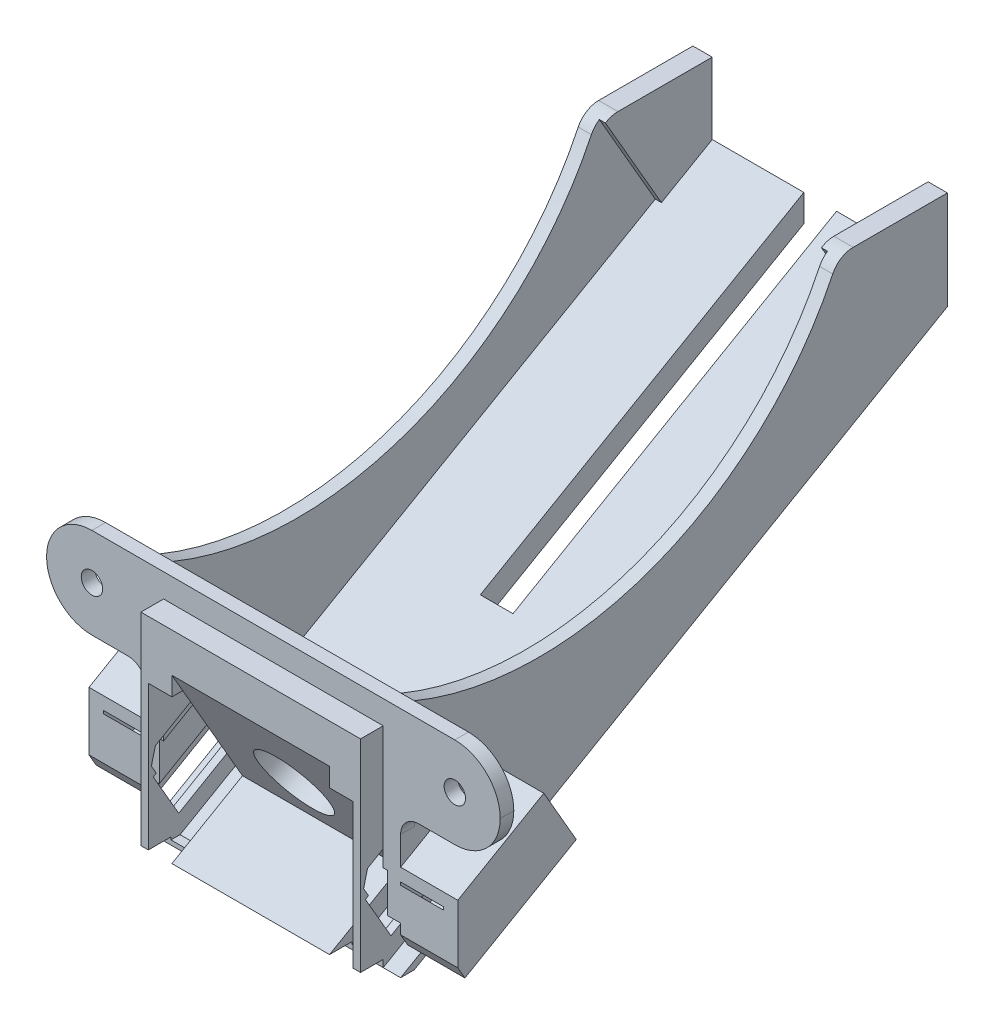
from build123d import *
from OCP.BRepAlgoAPI import BRepAlgoAPI_Cut
from OCP.TopTools import TopTools_ListOfShape

# Parameters (mm, degrees)
SKETCH2_R                       = 1.5
FRONT_PLATE_EXTRUDE_DEPTH       = 1.905
INSET_START                     = 1.905
SKETCH2_3_W                     = 30.746
SKETCH2_3_H                     = 28.321
SKETCH2_3_W_2                   = 28.746
SKETCH2_3_H_2                   = 26.321
INSET_EXTRUDE_DEPTH             = 3.175
BOTTLE_HOLDER_EXTRUDE_DEPTH     = 17.8125
BOTTLE_HOLDER_CUTOUT_DEPTH      = 15.113
SKETCH3_4_R                     = 45.655613694
ACCESS_HOLE_CUT1_DEPTH          = 11.03248959
SIPPER_HOLE_CUT_REACH           = 93.898
SKETCH6_R                       = 5.08
IR_LENS_1_DEPTH                 = 3.302
IR_START                        = 22.064979
IR_LENS_2_DEPTH                 = 3.302
IR_SLOT_CUT_OUTLINE_W           = 1.03851041
IR_SLOT_CUT_OUTLINE_H           = 10.146865
IR_SLOT_CUT_DEPTH               = 78.926684549
IR_MATRL_FILL_1_DEPTH           = 1.03851041
IR_START_2                      = -29.70749
IR_MATRL_FILL_2_DEPTH           = 1.03851041
CUT_EXTRUDE3_DEPTH              = 19.05
CUT_EXTRUDE3_DEPTH_BACK         = 7.62
SKETCH8_5_W                     = 2.439500062
SKETCH8_5_H                     = 5.73181937
CUT_EXTRUDE10_REACH             = 93.898
SKETCH32_W                      = 0.5999988
SKETCH32_H                      = 8.146865
CUT_EXTRUDE10_DIRECTION_2_REACH = 93.898
BOSS_EXTRUDE4_DEPTH             = 1.5
BOSS_EXTRUDE5_START             = -28.668979
BOSS_EXTRUDE5_DEPTH             = 1.5
FILLET4_R                       = 6.35
FILLET6_R                       = 3.175
WIRE_START                      = -3.28745457
WIRE_SLOT_CUT_OUTLINE_W         = 4.572
WIRE_SLOT_CUT_OUTLINE_H         = 52.293761458
WIRE_SLOT_CUT_DEPTH             = 3.28745457
FILLET9_R                       = 2.54
CUT_EXTRUDE11_REACH             = 86.319
SKETCH35_W                      = 0.8599988
SKETCH35_H                      = 17.011686888
FILLET10_START                  = -12.206513125
FILLET10_DEPTH                  = 1.838259089
FILLET10_START_2                = -10.368254036
FILLET10_2_DEPTH                = 1.274362516
FILLET10_START_3                = -9.318765864
FILLET10_3_DEPTH                = 1.318765864
BOSS_EXTRUDE6_DEPTH             = 8
SKETCH39_W                      = 6
SKETCH39_H                      = 6
CUT_EXTRUDE13_DEPTH             = 15
CUT_EXTRUDE14_DEPTH             = 8


with BuildPart() as part:
    # Sketch2 → Front Plate Extrude (new body)
    with BuildSketch(Plane.XY):
        Polygon((-31.75, 6.35), (31.75, 6.35), (31.75, -6.35), (17.8125, -6.35), (17.8125, -26.273), (-17.8125, -26.273), (-17.8125, -6.35), (-31.75, -6.35), align=None)
        with Locations(Location((-25.4, 0, 0), (0, 0, 180))):
            Circle(SKETCH2_R, mode=Mode.SUBTRACT)
        with Locations(Location((25.4, 0, 0), (0, 0, 180))):
            Circle(SKETCH2_R, mode=Mode.SUBTRACT)
    extrude(amount=FRONT_PLATE_EXTRUDE_DEPTH)

    # Sketch2<3> → Inset Extrude (add)
    # profile 1 of 2: a face of its own
    with BuildSketch(Plane.XY.offset(INSET_START)):
        with Locations((0, -11.1125)):
            Rectangle(SKETCH2_3_W, SKETCH2_3_H)
        with Locations((0, -11.1125)):
            Rectangle(SKETCH2_3_W_2, SKETCH2_3_H_2, mode=Mode.SUBTRACT)
    # profile 2 of 2: a face of its own
    with BuildSketch(Plane.XY.offset(INSET_START)):
        with Locations((0, -11.1125)):
            Rectangle(SKETCH2_3_W_2, SKETCH2_3_H_2)
    extrude(amount=INSET_EXTRUDE_DEPTH)

    # Sketch3 → Bottle Holder Extrude (add, symmetric)
    with BuildSketch(Plane(origin=(0, 0, 0), x_dir=(0, 0, -1), z_dir=(1, 0, 0))):
        with BuildLine():
            Line((0, 6.35), (0, -26.273))
            Line((0, -26.273), (74.637698823, 16.819095507))
            Line((74.637698823, 16.819095507), (74.637698823, 30.598392845))
            Line((74.637698823, 30.598392845), (59.397698823, 30.598392845))
            ThreePointArc((59.397698823, 30.598392845), (34.675938772, 6.282557302), (0, 6.35))
        make_face()
    extrude(amount=BOTTLE_HOLDER_EXTRUDE_DEPTH, both=True)

    # Sketch3<7> → Bottle Holder Cutout (cut, symmetric)
    with BuildSketch(Plane(origin=(0, 0, 0), x_dir=(0, 0, -1), z_dir=(1, 0, 0))):
        with BuildLine():
            ThreePointArc((59.397698823, 30.598392845), (34.675938772, 6.282557302), (0, 6.35))
            Line((0, 6.35), (8.989714143, -14.111334078))
            Line((8.989714143, -14.111334078), (41.609102242, 4.721478422))
            Line((41.609102242, 4.721478422), (42.984102242, 2.339908562))
            Line((42.984102242, 2.339908562), (74.637698823, 20.615121069))
            Line((74.637698823, 20.615121069), (74.637698823, 30.598392845))
            Line((74.637698823, 30.598392845), (59.397698823, 30.598392845))
        make_face()
        Polygon((10.102558342, -16.64425966), (8.989714143, -14.111334078), (41.609102242, 4.721478422), (42.984102242, 2.339908562), align=None)
    extrude(amount=BOTTLE_HOLDER_CUTOUT_DEPTH, both=True, mode=Mode.SUBTRACT)

    # Sketch3<4> → Access Hole Cut1 (cut, symmetric)
    with BuildSketch(Plane(origin=(0, 0, 0), x_dir=(0, 0, -1), z_dir=(1, 0, 0))):
        with Locations((17.420114638, 48.55159556)):
            Circle(SKETCH3_4_R)
        Polygon((-5.08, -2.441874335), (4.806167412, -19.565218584), (-5.08, -25.273), align=None)
        Polygon((8.989714143, -14.111334078), (41.609102242, 4.721478422), (42.984102242, 2.339908562), (10.102558342, -16.64425966), align=None)
    extrude(amount=ACCESS_HOLE_CUT1_DEPTH, both=True, mode=Mode.SUBTRACT)

    # Sipper Hole Cut: up to this plane
    sipper_hole_cut_end = Plane(origin=(-15.113, 1.027416141, -2.338484246), z_dir=(0, 0.40224099428432425, -0.9155338237974381))
    # Sketch6 → Sipper Hole Cut (cut, up to the surface)
    with BuildSketch(Plane(origin=(0, -2.810173109, 4.867362603), x_dir=(1, 0, 0), z_dir=(0, -0.5000000000000001, 0.8660254037844386)), mode=Mode.PRIVATE) as sipper_hole_cut_sk1:
        with Locations(Location((0, -11.72706003, 0), (0, 0, 270))):
            Circle(SKETCH6_R)
    sipper_hole_cut_tool1 = split(extrude(sipper_hole_cut_sk1.sketch, amount=-SIPPER_HOLE_CUT_REACH, mode=Mode.PRIVATE), bisect_by=sipper_hole_cut_end, keep=Keep.BOTH, mode=Mode.PRIVATE)
    add(sipper_hole_cut_tool1.solids().sort_by_distance((0, -12.966105, -0.996167))[0], mode=Mode.SUBTRACT)

    # Sketch9 → IR Lens 1 (cut)
    with BuildSketch(Plane.ZY.offset(-11.03248959)):
        Polygon((-8.275871937, -20.494923109), (0.635, -25.639617421), (5.08, -25.639617421), (5.08, -5.060840174), (0.635, -5.060840174), align=None)
    extrude(amount=-IR_LENS_1_DEPTH, mode=Mode.SUBTRACT)

    # Sketch9<2> → IR Lens 2 (cut)
    with BuildSketch(Plane.ZY.offset(-11.03248959).offset(IR_START)):
        Polygon((-8.275871937, -20.494923109), (0.635, -25.639617421), (5.08, -25.639617421), (5.08, -5.060840174), (0.635, -5.060840174), align=None)
    extrude(amount=IR_LENS_2_DEPTH, mode=Mode.SUBTRACT)

    # IR Slot Cut: read off the stored shape, not the designer's step
    # IR Slot Cut outline → IR Slot Cut (cut)
    with BuildSketch(Plane(origin=(0, -42.178380842, -10.278703561), x_dir=(1, 0, 0), z_dir=(0, 0.5000000000000007, -0.8660254037844383))):
        with Locations((-14.853744795, -27.274702716)):
            Rectangle(IR_SLOT_CUT_OUTLINE_W, IR_SLOT_CUT_OUTLINE_H)
        with Locations((14.853744795, -27.274702716)):
            Rectangle(IR_SLOT_CUT_OUTLINE_W, IR_SLOT_CUT_OUTLINE_H)
    extrude(amount=IR_SLOT_CUT_DEPTH, mode=Mode.SUBTRACT)

    # Sketch31 → IR Matrl Fill 1 (add)
    with BuildSketch(Plane(origin=(15.373, 0, 0), x_dir=(0, 0, -1), z_dir=(1, 0, 0))):
        Polygon((-4.090132963, -13.121823327), (-5.08, -13.693323327), (-5.08, -15.576325935), (-4.395369047, -16.76214153), (-3.962357211, -16.51214203), (-4.64949122, -15.321991015), align=None)
    extrude(amount=-IR_MATRL_FILL_1_DEPTH)

    # Sketch31<2> → IR Matrl Fill 2 (add)
    with BuildSketch(Plane(origin=(15.373, 0, 0), x_dir=(0, 0, -1), z_dir=(1, 0, 0)).offset(IR_START_2)):
        Polygon((-4.090132963, -13.121823327), (-5.08, -13.693323327), (-5.08, -15.576325935), (-4.395369047, -16.76214153), (-3.962357211, -16.51214203), (-4.64949122, -15.321991015), align=None)
    extrude(amount=-IR_MATRL_FILL_2_DEPTH)

    # Sketch8<5> → Cut-Extrude3 (cut, two sides: drawn at the far end of the back side and taken through both)
    with BuildSketch(Plane(origin=(0, -42.178380842, -10.278703561), x_dir=(1, 0, 0), z_dir=(0, 0.5000000000000007, -0.8660254037844383)).offset(-CUT_EXTRUDE3_DEPTH_BACK)):
        with Locations((16.592750031, -22.732225331)):
            Rectangle(SKETCH8_5_W, SKETCH8_5_H)
        with Locations((-16.592750031, -22.732225331)):
            Rectangle(SKETCH8_5_W, SKETCH8_5_H)
    extrude(amount=CUT_EXTRUDE3_DEPTH + CUT_EXTRUDE3_DEPTH_BACK, mode=Mode.SUBTRACT)

    # Cut-Extrude10: up to this face of the body (flat: up to its plane)
    cut_extrude10_end = Plane(part.part.faces().sort_by_distance((15.243, 20.905546866, -64.993866059))[0])
    # Sketch32 → Cut-Extrude10 (cut, up to the picked face)
    with BuildSketch(Plane(origin=(0, -2.810173109, 4.867362603), x_dir=(1, 0, 0), z_dir=(0, -0.5000000000000006, 0.8660254037844383)), mode=Mode.PRIVATE) as cut_extrude10_sk1:
        with Locations((15.6729994, -15.392198364)):
            Rectangle(SKETCH32_W, SKETCH32_H)
    cut_extrude10_tool1 = split(extrude(cut_extrude10_sk1.sketch, amount=-CUT_EXTRUDE10_REACH, mode=Mode.PRIVATE), bisect_by=cut_extrude10_end, keep=Keep.BOTH, mode=Mode.PRIVATE)
    # Sketch32 → Cut-Extrude10 (cut, up to the picked face)
    with BuildSketch(Plane(origin=(0, -2.810173109, 4.867362603), x_dir=(1, 0, 0), z_dir=(0, -0.5000000000000006, 0.8660254037844383)), mode=Mode.PRIVATE) as cut_extrude10_sk2:
        with Locations((-15.6729994, -15.392198364)):
            Rectangle(SKETCH32_W, SKETCH32_H)
    cut_extrude10_tool2 = split(extrude(cut_extrude10_sk2.sketch, amount=-CUT_EXTRUDE10_REACH, mode=Mode.PRIVATE), bisect_by=cut_extrude10_end, keep=Keep.BOTH, mode=Mode.PRIVATE)
    add(cut_extrude10_tool1.solids().sort_by(Axis((15.672999, -16.140208, -2.828737), (0, 0.5000000000000006, -0.8660254037844383)))[0], mode=Mode.SUBTRACT)
    add(cut_extrude10_tool2.solids().sort_by(Axis((-15.672999, -16.140208, -2.828737), (0, 0.5000000000000006, -0.8660254037844383)))[0], mode=Mode.SUBTRACT)

    # Cut-Extrude10 direction 2: up to this face of the body (flat: up to its plane)
    cut_extrude10_direction_2_end = Plane(part.part.faces().sort_by_distance((14.853744795, -19.856829184, 2.608650297))[0])
    # Sketch32 → Cut-Extrude10 direction 2 (cut, up to the picked face)
    with BuildSketch(Plane(origin=(0, -2.810173109, 4.867362603), x_dir=(1, 0, 0), z_dir=(0, -0.5000000000000006, 0.8660254037844383)), mode=Mode.PRIVATE) as cut_extrude10_direction_2_sk1:
        with Locations((15.6729994, -15.392198364)):
            Rectangle(SKETCH32_W, SKETCH32_H)
    cut_extrude10_direction_2_tool1 = split(extrude(cut_extrude10_direction_2_sk1.sketch, amount=CUT_EXTRUDE10_DIRECTION_2_REACH, mode=Mode.PRIVATE), bisect_by=cut_extrude10_direction_2_end, keep=Keep.BOTH, mode=Mode.PRIVATE)
    # Sketch32 → Cut-Extrude10 direction 2 (cut, up to the picked face)
    with BuildSketch(Plane(origin=(0, -2.810173109, 4.867362603), x_dir=(1, 0, 0), z_dir=(0, -0.5000000000000006, 0.8660254037844383)), mode=Mode.PRIVATE) as cut_extrude10_direction_2_sk2:
        with Locations((-15.6729994, -15.392198364)):
            Rectangle(SKETCH32_W, SKETCH32_H)
    cut_extrude10_direction_2_tool2 = split(extrude(cut_extrude10_direction_2_sk2.sketch, amount=CUT_EXTRUDE10_DIRECTION_2_REACH, mode=Mode.PRIVATE), bisect_by=cut_extrude10_direction_2_end, keep=Keep.BOTH, mode=Mode.PRIVATE)
    add(cut_extrude10_direction_2_tool1.solids().sort_by(Axis((15.672999, -16.140208, -2.828737), (0, -0.5000000000000006, 0.8660254037844383)))[0], mode=Mode.SUBTRACT)
    add(cut_extrude10_direction_2_tool2.solids().sort_by(Axis((-15.672999, -16.140208, -2.828737), (0, -0.5000000000000006, 0.8660254037844383)))[0], mode=Mode.SUBTRACT)

    # Sketch34 → Boss-Extrude4 (add)
    with BuildSketch(Plane(origin=(14.33448959, 0, 0), x_dir=(0, 0, -1), z_dir=(1, 0, 0))):
        Polygon((6.805761449, -9.140476832), (10.102558342, -16.64425966), (14.227004327, -14.26300966), (10.930207434, -6.759226832), align=None)
    extrude(amount=-BOSS_EXTRUDE4_DEPTH)

    # Sketch34<2> → Boss-Extrude5 (add)
    with BuildSketch(Plane(origin=(14.33448959, 0, 0), x_dir=(0, 0, -1), z_dir=(1, 0, 0)).offset(BOSS_EXTRUDE5_START)):
        Polygon((6.805761449, -9.140476832), (10.102558342, -16.64425966), (14.227004327, -14.26300966), (10.930207434, -6.759226832), align=None)
    extrude(amount=BOSS_EXTRUDE5_DEPTH)

    # Fillet4
    fillet4_edges = [part.edges().sort_by_distance(p)[0] for p in [
        (-31.75, -6.35, 0.9525),
        (31.75, -6.35, 0.9525),
        (31.75, 6.35, 0.9525),
        (-31.75, 6.35, 0.9525),
    ]]
    fillet(fillet4_edges, radius=FILLET4_R - 0.0001)  # a hair under: the kernel refuses the full size

    # Fillet6
    fillet6_edges = [part.edges().sort_by_distance(p)[0] for p in [
        (16.46275, 30.598392845, -59.397698823),
        (-16.46275, 30.598392845, -59.397698823),
    ]]
    fillet(fillet6_edges, radius=FILLET6_R)

    # Wire Slot Cut: read off the stored shape, not the designer's step
    # Wire Slot Cut outline → Wire Slot Cut (cut)
    with BuildSketch(Plane(origin=(0, -16.857730829, -9.732815432), x_dir=(1, 0, 0), z_dir=(0, 0.8660254037844386, 0.5000000000000002)).offset(WIRE_START)):
        with Locations((0, 48.798823066)):
            Rectangle(WIRE_SLOT_CUT_OUTLINE_W, WIRE_SLOT_CUT_OUTLINE_H)
    extrude(amount=WIRE_SLOT_CUT_DEPTH, mode=Mode.SUBTRACT)

    # Fillet9
    fillet9_edges = [part.edges().sort_by_distance(p)[0] for p in [
        (17.8125, -6.35, 0.9525),
        (-17.8125, -6.35, 0.9525),
    ]]
    fillet(fillet9_edges, radius=FILLET9_R)

    # Cut-Extrude11: up to this face of the body (flat: up to its plane)
    cut_extrude11_end = Plane(part.part.faces().sort_by_distance((15.522272109, 20.343088544, -65.318601523))[0])
    # Sketch35 → Cut-Extrude11 (cut, up to the picked face)
    with BuildSketch(Plane(origin=(0, 1.027416141, -2.338484246), x_dir=(-1, 0, 0), z_dir=(0, 0.4022409942843238, -0.9155338237974383)), mode=Mode.PRIVATE) as cut_extrude11_sk1:
        with Locations((-15.5429994, -2.692203663)):
            Rectangle(SKETCH35_W, SKETCH35_H)
    cut_extrude11_tool1 = split(extrude(cut_extrude11_sk1.sketch, amount=CUT_EXTRUDE11_REACH, mode=Mode.PRIVATE), bisect_by=cut_extrude11_end, keep=Keep.BOTH, mode=Mode.PRIVATE)
    # Sketch35 → Cut-Extrude11 (cut, up to the picked face)
    with BuildSketch(Plane(origin=(0, 1.027416141, -2.338484246), x_dir=(-1, 0, 0), z_dir=(0, 0.4022409942843238, -0.9155338237974383)), mode=Mode.PRIVATE) as cut_extrude11_sk2:
        with Locations((15.5429994, -2.692203663)):
            Rectangle(SKETCH35_W, SKETCH35_H)
    cut_extrude11_tool2 = split(extrude(cut_extrude11_sk2.sketch, amount=CUT_EXTRUDE11_REACH, mode=Mode.PRIVATE), bisect_by=cut_extrude11_end, keep=Keep.BOTH, mode=Mode.PRIVATE)
    add(cut_extrude11_tool1.solids().sort_by(Axis((15.542999, -1.437387, -3.421399), (0, 0.4022409942843238, -0.9155338237974383)))[0], mode=Mode.SUBTRACT)
    add(cut_extrude11_tool2.solids().sort_by(Axis((-15.542999, -1.437387, -3.421399), (0, 0.4022409942843238, -0.9155338237974383)))[0], mode=Mode.SUBTRACT)


with BuildPart() as fillet10_tool:
    # Fillet10: read off the stored shape, not the designer's step
    # Fillet10 outline → Fillet10 (new body)
    with BuildSketch(Plane(origin=(0, 0, 0), x_dir=(1, 0, 0), z_dir=(0, 0.9155338237972743, 0.4022409942846968)).offset(FILLET10_START)):
        with BuildLine():
            Line((15.373, 2.554230314), (15.373, -0.656374007))
            add(Edge.make_bspline(
                [(15.373, -0.656374007), (15.373, 1.004992141), (15.9729988, 2.554230314)],
                knots=[0, 0, 0, 1, 1, 1], degree=2, weights=[1, 0.052631579, 1]))
            Line((15.9729988, 2.554230314), (15.373, 2.554230314))
        make_face()
        with BuildLine():
            Line((-15.373, -0.656374007), (-15.373, 2.554230314))
            Line((-15.373, 2.554230314), (-15.9729988, 2.554230314))
            add(Edge.make_bspline(
                [(-15.373, -0.656374007), (-15.373, 1.004992141), (-15.9729988, 2.554230314)],
                knots=[0, 0, 0, 1, 1, 1], degree=2, weights=[1, 0.052631579, 1]))
        make_face()
    extrude(amount=FILLET10_DEPTH)


with BuildPart() as part_1:
    add(part.part)

    # Fillet10: cut by fillet10_tool, with a tolerance
    fillet10_stock = TopTools_ListOfShape()
    fillet10_stock.Append(part_1.part.wrapped)
    fillet10_tools = TopTools_ListOfShape()
    fillet10_tools.Append(fillet10_tool.part.wrapped)
    fillet10_cut = BRepAlgoAPI_Cut()
    fillet10_cut.SetArguments(fillet10_stock)
    fillet10_cut.SetTools(fillet10_tools)
    fillet10_cut.SetFuzzyValue(0.00001)
    fillet10_cut.Build()
    add(Compound.cast(fillet10_cut.Shape()).solids(), mode=Mode.REPLACE)


with BuildPart() as fillet10_2_tool:
    # Fillet10 2 outline → Fillet10 2 (new body)
    with BuildSketch(Plane(origin=(0, 0, 0), x_dir=(1, 0, 0), z_dir=(0, 0.9155338237972743, 0.4022409942846968)).offset(FILLET10_START_2)):
        with BuildLine():
            Line((15.373, 2.554230314), (15.373, -0.656374007))
            add(Edge.make_bspline(
                [(15.373, -0.656374007), (15.373, 1.004992141), (15.9729988, 2.554230314)],
                knots=[0, 0, 0, 1, 1, 1], degree=2, weights=[1, 0.052631579, 1]))
            Line((15.9729988, 2.554230314), (15.373, 2.554230314))
        make_face()
        with BuildLine():
            Line((-15.373, -0.656374007), (-15.373, 2.554230314))
            Line((-15.373, 2.554230314), (-15.9729988, 2.554230314))
            add(Edge.make_bspline(
                [(-15.373, -0.656374007), (-15.373, 1.004992141), (-15.9729988, 2.554230314)],
                knots=[0, 0, 0, 1, 1, 1], degree=2, weights=[1, 0.052631579, 1]))
        make_face()
    extrude(amount=FILLET10_2_DEPTH)


with BuildPart() as part_2:
    add(part_1.part)

    # Fillet10 2: cut by fillet10_2_tool, with a tolerance
    fillet10_2_stock = TopTools_ListOfShape()
    fillet10_2_stock.Append(part_2.part.wrapped)
    fillet10_2_tools = TopTools_ListOfShape()
    fillet10_2_tools.Append(fillet10_2_tool.part.wrapped)
    fillet10_2_cut = BRepAlgoAPI_Cut()
    fillet10_2_cut.SetArguments(fillet10_2_stock)
    fillet10_2_cut.SetTools(fillet10_2_tools)
    fillet10_2_cut.SetFuzzyValue(0.00001)
    fillet10_2_cut.Build()
    add(Compound.cast(fillet10_2_cut.Shape()).solids(), mode=Mode.REPLACE)


with BuildPart() as fillet10_3_tool:
    # Fillet10 3 outline → Fillet10 3 (new body)
    with BuildSketch(Plane(origin=(0, 0, 0), x_dir=(1, 0, 0), z_dir=(0, 0.866025403784438, 0.500000000000001)).offset(FILLET10_START_3)):
        with BuildLine():
            Line((-15.373, -1.686119404), (-15.373, -10.103070715))
            Line((-15.373, -10.103070715), (-14.33448959, -10.103070715))
            Line((-14.33448959, -10.103070715), (-14.33448959, 1.543877668))
            Line((-14.33448959, 1.543877668), (-15.9729988, 1.543877668))
            add(Edge.make_bspline(
                [(-15.9729988, 1.543877668), (-15.971207149, 1.538076552), (-15.969571125, 1.532234755), (-15.964768513, 1.513798515), (-15.961985473, 1.501104663), (-15.954761434, 1.467993542), (-15.950341901, 1.447576091), (-15.939893171, 1.398235505), (-15.933955207, 1.369291076), (-15.910909064, 1.256006864), (-15.894158413, 1.171599572), (-15.854810276, 0.971102353), (-15.832371387, 0.854980502), (-15.801135896, 0.69193635), (-15.792183679, 0.645043415), (-15.771810979, 0.538001244), (-15.760407516, 0.477848753), (-15.735012858, 0.343448661), (-15.721040727, 0.269197458), (-15.69067164, 0.107184396), (-15.674295309, 0.019418673), (-15.64164936, -0.156311863), (-15.625380017, -0.244276729), (-15.59549522, -0.406606895), (-15.581859005, -0.48096837), (-15.557298295, -0.615503424), (-15.546353468, -0.675673292), (-15.526971999, -0.782673019), (-15.518517809, -0.829499715), (-15.489133614, -0.992793414), (-15.468343488, -1.109286023), (-15.433023894, -1.310574676), (-15.418334475, -1.395343423), (-15.399171891, -1.509305031), (-15.394325847, -1.538429955), (-15.386376005, -1.588191869), (-15.383177727, -1.608815715), (-15.378051102, -1.642281951), (-15.376100068, -1.655116427), (-15.373974731, -1.674030896), (-15.373407637, -1.680066264), (-15.373, -1.686119404)],
                knots=[0, 0, 0, 0, 0.018202258, 0.018202258, 0.057173389, 0.057173389, 0.119855118, 0.119855118, 0.208491493, 0.208491493, 0.466656687, 0.466656687, 0.821464439, 0.821464439, 0.96468403, 0.96468403, 1.148355589, 1.148355589, 1.375018616, 1.375018616, 1.642860059, 1.642860059, 1.911230264, 1.911230264, 2.138034472, 2.138034472, 2.321506022, 2.321506022, 2.464257422, 2.464257422, 2.819255112, 2.819255112, 3.077356437, 3.077356437, 3.165927054, 3.165927054, 3.22854891, 3.22854891, 3.267479779, 3.267479779, 3.28566819, 3.28566819, 3.28566819, 3.28566819], degree=3))
        make_face()
        with BuildLine():
            Line((15.9729988, 1.543877668), (14.33448959, 1.543877668))
            Line((14.33448959, 1.543877668), (14.33448959, -10.103070715))
            Line((14.33448959, -10.103070715), (15.373, -10.103070715))
            Line((15.373, -10.103070715), (15.373, -1.686119404))
            add(Edge.make_bspline(
                [(15.373, -1.686119404), (15.373407663, -1.680066011), (15.373974788, -1.674030391), (15.376100251, -1.655114986), (15.378051402, -1.642279828), (15.383178353, -1.608811675), (15.386376838, -1.588186595), (15.394327216, -1.538421551), (15.399173594, -1.509294736), (15.418337569, -1.395325297), (15.433028064, -1.310550616), (15.468350268, -1.109247726), (15.489141937, -0.992746815), (15.518527407, -0.829446507), (15.526981313, -0.782621499), (15.546362394, -0.675624158), (15.557307117, -0.615454985), (15.581867816, -0.480920241), (15.595504126, -0.406558381), (15.625389309, -0.244226402), (15.641658944, -0.15626011), (15.674304958, 0.01947046), (15.690681057, 0.10723479), (15.721049863, 0.269246081), (15.735021947, 0.343496904), (15.760416707, 0.47789729), (15.77182032, 0.538050453), (15.792193506, 0.645094937), (15.801146057, 0.691989511), (15.832380359, 0.855027003), (15.854817705, 0.971140558), (15.89416316, 1.171623556), (15.910912682, 1.256024921), (15.93395731, 1.369301319), (15.939894907, 1.398243858), (15.950343014, 1.447581327), (15.954762297, 1.467997547), (15.961985953, 1.501106758), (15.964768858, 1.51379993), (15.969571252, 1.532235248), (15.971207215, 1.538076798), (15.9729988, 1.543877668)],
                knots=[0, 0, 0, 0, 0.018189173, 0.018189173, 0.057122116, 0.057122116, 0.11974773, 0.11974773, 0.208324112, 0.208324112, 0.466443528, 0.466443528, 0.821466551, 0.821466551, 0.964212812, 0.964212812, 1.147682253, 1.147682253, 1.374487649, 1.374487649, 1.642862223, 1.642862223, 1.910699431, 1.910699431, 2.137361313, 2.137361313, 2.321034939, 2.321034939, 2.46425955, 2.46425955, 2.819041988, 2.819041988, 3.07718908, 3.07718908, 3.165819682, 3.165819682, 3.228497644, 3.228497644, 3.267466697, 3.267466697, 3.28566819, 3.28566819, 3.28566819, 3.28566819], degree=3))
        make_face()
    extrude(amount=FILLET10_3_DEPTH)


with BuildPart() as part_3:
    add(part_2.part)


with BuildPart() as part_4:
    # Fillet10 3: joined with fillet10_3_tool
    add(part_3.part.fuse(fillet10_3_tool.part, tol=0.00001))

    # Sketch37 → Boss-Extrude6 (add)
    with BuildSketch(Plane(origin=(17.8125, 0, 0), x_dir=(0, 0, -1), z_dir=(1, 0, 0))):
        Polygon((-1.905, -21.075587249), (-4.455, -16.65885769), (-5.455, -14.926806882), (10.133457268, -5.926806882), (14.683457268, -13.807638056), (-0.905, -22.807638056), align=None)
    boss_extrude6 = extrude(amount=BOSS_EXTRUDE6_DEPTH)

    # Sketch39 → Cut-Extrude13 (cut)
    with BuildSketch(Plane(origin=(0, 2.906213991, -5.03371029), x_dir=(-1, 0, 0), z_dir=(0, 0.5000000000000006, -0.8660254037844384))):
        with Locations((-20.8125, -14.749493957)):
            Rectangle(SKETCH39_W, SKETCH39_H)
    cut_extrude13 = extrude(amount=-CUT_EXTRUDE13_DEPTH, mode=Mode.SUBTRACT)

    # Sketch40 → Cut-Extrude14 (cut)
    with BuildSketch(Plane.ZY.offset(-17.8125)):
        Polygon((1.905, -12.877213426), (1.905, -21.075587249), (5.455, -14.926806882), align=None)
    cut_extrude14 = extrude(amount=-CUT_EXTRUDE14_DEPTH, mode=Mode.SUBTRACT)

    # Mirror1: Boss-Extrude6, Cut-Extrude13, Cut-Extrude14 across plane
    add(boss_extrude6.mirror(Plane.ZY))
    add(cut_extrude13.mirror(Plane.ZY), mode=Mode.SUBTRACT)
    add(cut_extrude14.mirror(Plane.ZY), mode=Mode.SUBTRACT)


solid = part_4.part
